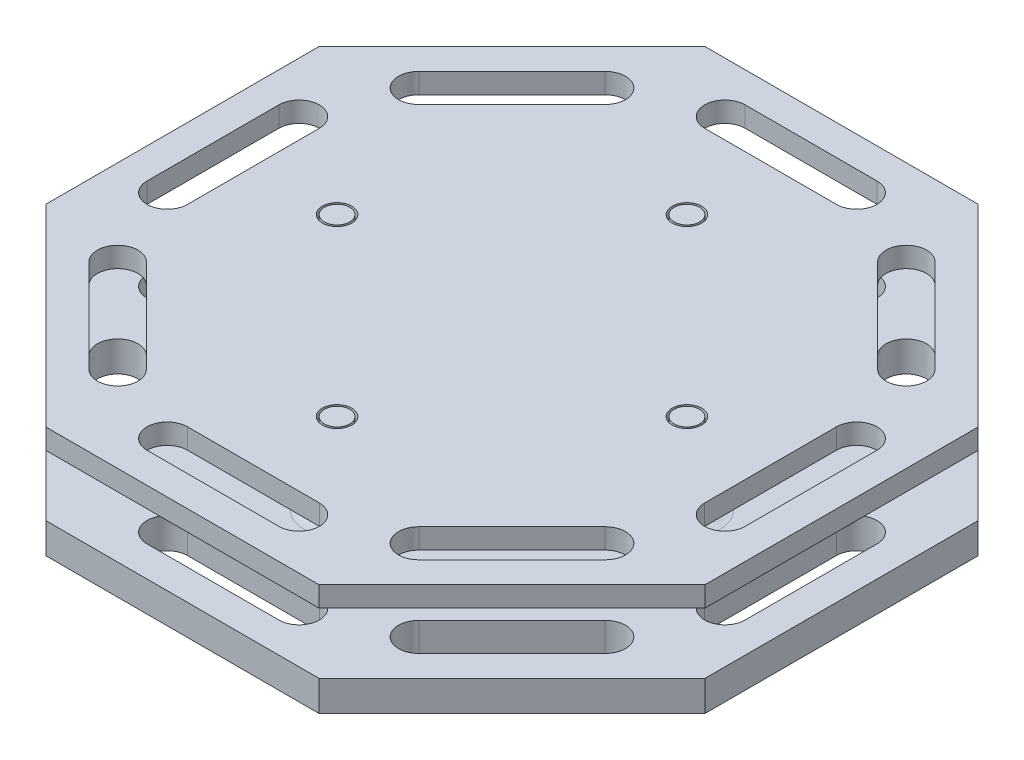
from build123d import *

# Parameters (mm, degrees)
SKETCH1_R           = 1.5
BOSS_EXTRUDE1_DEPTH = 3.81
SKETCH2_R           = 1.5875
BOSS_EXTRUDE2_DEPTH = 10.16
FILLET1_R           = 2.54
BOSS_EXTRUDE3_START = -2.54
SKETCH3_R           = 1.8415
BOSS_EXTRUDE3_DEPTH = 2.54


with BuildPart() as part:
    # Sketch1 → Boss-Extrude1 (new body)
    with BuildSketch(Plane(origin=(0, 0, 0), x_dir=(1, 0, 0), z_dir=(0, 1, 0))):
        Polygon((41.275, 17.096664787), (17.096664787, 41.275), (-17.096664787, 41.275), (-41.275, 17.096664787), (-41.275, -17.096664787), (-17.096664787, -41.275), (17.096664787, -41.275), (41.275, -17.096664787), align=None)
        with Locations((-17.78, 5.969)):
            Circle(SKETCH1_R, mode=Mode.SUBTRACT)
        with Locations((-17.78, -5.969)):
            Circle(SKETCH1_R, mode=Mode.SUBTRACT)
        with Locations((5.969, 17.78)):
            Circle(SKETCH1_R, mode=Mode.SUBTRACT)
        with Locations((-5.969, 17.78)):
            Circle(SKETCH1_R, mode=Mode.SUBTRACT)
        with Locations((17.78, -5.969)):
            Circle(SKETCH1_R, mode=Mode.SUBTRACT)
        with Locations((17.78, 5.969)):
            Circle(SKETCH1_R, mode=Mode.SUBTRACT)
        with Locations((-5.969, -17.78)):
            Circle(SKETCH1_R, mode=Mode.SUBTRACT)
        with Locations((5.969, -17.78)):
            Circle(SKETCH1_R, mode=Mode.SUBTRACT)
        with BuildLine():
            Line((-8.255, 37.465), (8.255, 37.465))
            ThreePointArc((8.255, 37.465), (10.795, 34.925), (8.255, 32.385))
            Line((8.255, 32.385), (-8.255, 32.385))
            ThreePointArc((-8.255, 32.385), (-10.795, 34.925), (-8.255, 37.465))
        make_face(mode=Mode.SUBTRACT)
        with BuildLine():
            Line((17.06248663, 28.736819587), (28.736819587, 17.06248663))
            ThreePointArc((28.736819587, 17.06248663), (32.328922036, 17.06248663), (32.328922036, 20.654589078))
            Line((32.328922036, 20.654589078), (20.654589078, 32.328922036))
            ThreePointArc((20.654589078, 32.328922036), (17.06248663, 32.328922036), (17.06248663, 28.736819587))
        make_face(mode=Mode.SUBTRACT)
        with BuildLine():
            Line((32.385, 8.255), (32.385, -8.255))
            ThreePointArc((32.385, -8.255), (34.925, -10.795), (37.465, -8.255))
            Line((37.465, -8.255), (37.465, 8.255))
            ThreePointArc((37.465, 8.255), (34.925, 10.795), (32.385, 8.255))
        make_face(mode=Mode.SUBTRACT)
        with BuildLine():
            Line((28.736819587, -17.06248663), (17.06248663, -28.736819587))
            ThreePointArc((17.06248663, -28.736819587), (17.06248663, -32.328922036), (20.654589078, -32.328922036))
            Line((20.654589078, -32.328922036), (32.328922036, -20.654589078))
            ThreePointArc((32.328922036, -20.654589078), (32.328922036, -17.06248663), (28.736819587, -17.06248663))
        make_face(mode=Mode.SUBTRACT)
        with BuildLine():
            Line((8.255, -32.385), (-8.255, -32.385))
            ThreePointArc((-8.255, -32.385), (-10.795, -34.925), (-8.255, -37.465))
            Line((-8.255, -37.465), (8.255, -37.465))
            ThreePointArc((8.255, -37.465), (10.795, -34.925), (8.255, -32.385))
        make_face(mode=Mode.SUBTRACT)
        with BuildLine():
            Line((-17.06248663, -28.736819587), (-28.736819587, -17.06248663))
            ThreePointArc((-28.736819587, -17.06248663), (-32.328922036, -17.06248663), (-32.328922036, -20.654589078))
            Line((-32.328922036, -20.654589078), (-20.654589078, -32.328922036))
            ThreePointArc((-20.654589078, -32.328922036), (-17.06248663, -32.328922036), (-17.06248663, -28.736819587))
        make_face(mode=Mode.SUBTRACT)
        with BuildLine():
            Line((-32.385, -8.255), (-32.385, 8.255))
            ThreePointArc((-32.385, 8.255), (-34.925, 10.795), (-37.465, 8.255))
            Line((-37.465, 8.255), (-37.465, -8.255))
            ThreePointArc((-37.465, -8.255), (-34.925, -10.795), (-32.385, -8.255))
        make_face(mode=Mode.SUBTRACT)
        with BuildLine():
            Line((-28.736819587, 17.06248663), (-17.06248663, 28.736819587))
            ThreePointArc((-17.06248663, 28.736819587), (-17.06248663, 32.328922036), (-20.654589078, 32.328922036))
            Line((-20.654589078, 32.328922036), (-32.328922036, 20.654589078))
            ThreePointArc((-32.328922036, 20.654589078), (-32.328922036, 17.06248663), (-28.736819587, 17.06248663))
        make_face(mode=Mode.SUBTRACT)
    extrude(amount=BOSS_EXTRUDE1_DEPTH)

    # Sketch2 → Boss-Extrude2 (add)
    with BuildSketch(Plane(origin=(0, 3.81, 0), x_dir=(1, 0, 0), z_dir=(0, 1, 0))):
        with Locations((-21.911824935, 0)):
            Circle(SKETCH2_R)
        with Locations((21.911824935, 0)):
            Circle(SKETCH2_R)
        with Locations((0, 21.911824935)):
            Circle(SKETCH2_R)
        with Locations((0, -21.911824935)):
            Circle(SKETCH2_R)
    extrude(amount=BOSS_EXTRUDE2_DEPTH)

    # Fillet1
    fillet1_edges = [part.edges().sort_by_distance(p)[0] for p in [
        (-1.5875, 3.81, 21.911824935),
        (20.324324935, 3.81, 0),
        (-1.5875, 3.81, -21.911824935),
        (-23.499324935, 3.81, 0),
    ]]
    fillet(fillet1_edges, radius=FILLET1_R)


with BuildPart() as body_2:
    # Sketch3 → Boss-Extrude3 (new body)
    with BuildSketch(Plane(origin=(0, 13.97, 0), x_dir=(1, 0, 0), z_dir=(0, 1, 0)).offset(BOSS_EXTRUDE3_START)):
        Polygon((17.096664787, -41.275), (41.275, -17.096664787), (41.275, 17.096664787), (17.096664787, 41.275), (-17.096664787, 41.275), (-41.275, 17.096664787), (-41.275, -17.096664787), (-17.096664787, -41.275), align=None)
        with BuildLine():
            Line((-20.654589078, -32.328922036), (-32.328922036, -20.654589078))
            ThreePointArc((-32.328922036, -20.654589078), (-32.328922036, -17.06248663), (-28.736819587, -17.06248663))
            Line((-28.736819587, -17.06248663), (-17.06248663, -28.736819587))
            ThreePointArc((-17.06248663, -28.736819587), (-17.06248663, -32.328922036), (-20.654589078, -32.328922036))
        make_face(mode=Mode.SUBTRACT)
        with BuildLine():
            Line((-37.465, -8.255), (-37.465, 8.255))
            ThreePointArc((-37.465, 8.255), (-34.925, 10.795), (-32.385, 8.255))
            Line((-32.385, 8.255), (-32.385, -8.255))
            ThreePointArc((-32.385, -8.255), (-34.925, -10.795), (-37.465, -8.255))
        make_face(mode=Mode.SUBTRACT)
        with BuildLine():
            Line((8.255, -37.465), (-8.255, -37.465))
            ThreePointArc((-8.255, -37.465), (-10.795, -34.925), (-8.255, -32.385))
            Line((-8.255, -32.385), (8.255, -32.385))
            ThreePointArc((8.255, -32.385), (10.795, -34.925), (8.255, -37.465))
        make_face(mode=Mode.SUBTRACT)
        with Locations((0, -21.911824935)):
            Circle(SKETCH3_R, mode=Mode.SUBTRACT)
        with BuildLine():
            Line((32.328922036, -20.654589078), (20.654589078, -32.328922036))
            ThreePointArc((20.654589078, -32.328922036), (17.06248663, -32.328922036), (17.06248663, -28.736819587))
            Line((17.06248663, -28.736819587), (28.736819587, -17.06248663))
            ThreePointArc((28.736819587, -17.06248663), (32.328922036, -17.06248663), (32.328922036, -20.654589078))
        make_face(mode=Mode.SUBTRACT)
        with Locations((-21.911824935, 0)):
            Circle(SKETCH3_R, mode=Mode.SUBTRACT)
        with BuildLine():
            Line((-32.328922036, 20.654589078), (-20.654589078, 32.328922036))
            ThreePointArc((-20.654589078, 32.328922036), (-17.06248663, 32.328922036), (-17.06248663, 28.736819587))
            Line((-17.06248663, 28.736819587), (-28.736819587, 17.06248663))
            ThreePointArc((-28.736819587, 17.06248663), (-32.328922036, 17.06248663), (-32.328922036, 20.654589078))
        make_face(mode=Mode.SUBTRACT)
        with Locations((21.911824935, 0)):
            Circle(SKETCH3_R, mode=Mode.SUBTRACT)
        with BuildLine():
            Line((37.465, 8.255), (37.465, -8.255))
            ThreePointArc((37.465, -8.255), (34.925, -10.795), (32.385, -8.255))
            Line((32.385, -8.255), (32.385, 8.255))
            ThreePointArc((32.385, 8.255), (34.925, 10.795), (37.465, 8.255))
        make_face(mode=Mode.SUBTRACT)
        with Locations((0, 21.911824935)):
            Circle(SKETCH3_R, mode=Mode.SUBTRACT)
        with BuildLine():
            Line((8.255, 32.385), (-8.255, 32.385))
            ThreePointArc((-8.255, 32.385), (-10.795, 34.925), (-8.255, 37.465))
            Line((-8.255, 37.465), (8.255, 37.465))
            ThreePointArc((8.255, 37.465), (10.795, 34.925), (8.255, 32.385))
        make_face(mode=Mode.SUBTRACT)
        with BuildLine():
            Line((28.736819587, 17.06248663), (17.06248663, 28.736819587))
            ThreePointArc((17.06248663, 28.736819587), (17.06248663, 32.328922036), (20.654589078, 32.328922036))
            Line((20.654589078, 32.328922036), (32.328922036, 20.654589078))
            ThreePointArc((32.328922036, 20.654589078), (32.328922036, 17.06248663), (28.736819587, 17.06248663))
        make_face(mode=Mode.SUBTRACT)
    extrude(amount=BOSS_EXTRUDE3_DEPTH)


solid = Compound([part.part, body_2.part])
